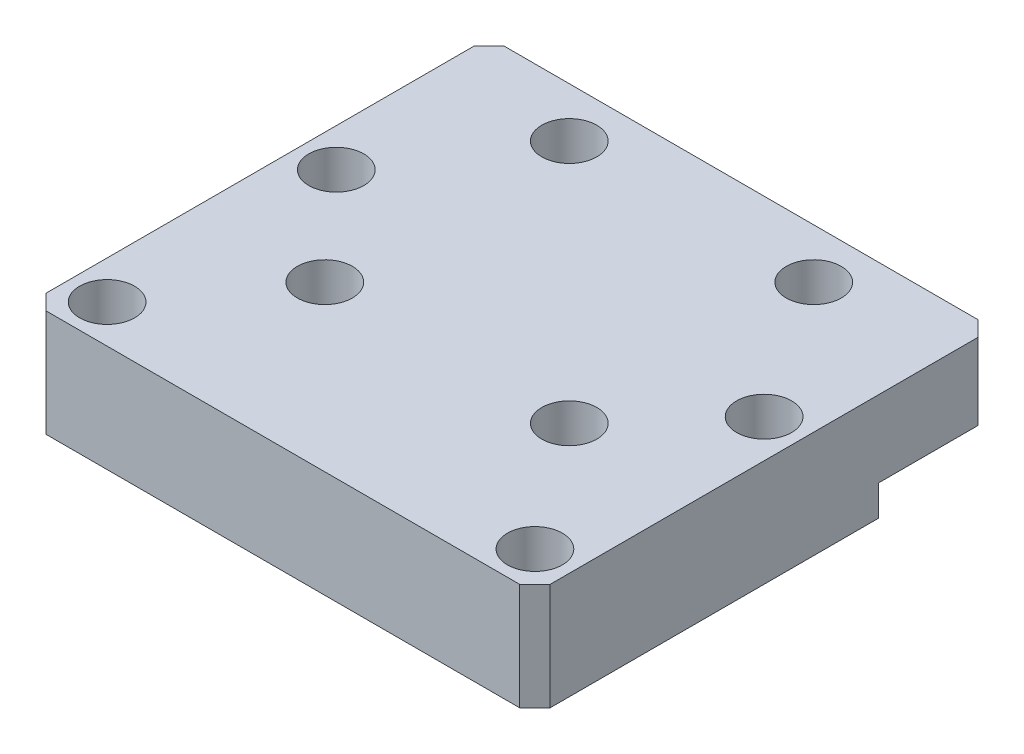
from build123d import *

# Parameters (mm, degrees)
BOSS_EXTRUDE1_DEPTH                                  = 7
M3_CLEARANCE_HOLE1_D                                 = 3.6
CUT_EXTRUDE1_DEPTH                                   = 22.16158075380949
CUT_EXTRUDE1_DEPTH_BACK                              = 2
BOSS_EXTRUDE2_DEPTH                                  = 5
FILLET1_R                                            = 5.5
CHAMFER1_SIZE                                        = 1
CBORE_FOR_M3_HEXAGON_SOCKET_HEAD_CAP_SCR_D           = 3.6
CBORE_FOR_M3_HEXAGON_SOCKET_HEAD_CAP_SCR_CBORE_D     = 6
CBORE_FOR_M3_HEXAGON_SOCKET_HEAD_CAP_SCR_CBORE_DEPTH = 4.4
FILLET2_R                                            = 2


with BuildPart() as part:
    # Sketch1 → Boss-Extrude1 (new body)
    with BuildSketch(Plane(origin=(0, 0, 0), x_dir=(1, 0, 0), z_dir=(0, 1, 0))):
        Polygon((16.5, -11.249999999999996), (-16.499999999999996, -11.250000000000002), (-16.499999999999996, 11.249999999999998), (16.500000000000004, 11.250000000000002), align=None)
    extrude(amount=BOSS_EXTRUDE1_DEPTH)

    # M3 Clearance Hole1 (through all)
    with Locations(Plane(origin=(-14, 7, -6.25), x_dir=(0, 0, 1), z_dir=(0, 1, 0))):
        with Locations((0, 0), (0, 28), (15, 28), (15, 0)):
            Hole(M3_CLEARANCE_HOLE1_D / 2)

    # Sketch7 → Cut-Extrude1 (cut, two sides: drawn at the far end of the back side and taken through both)
    with BuildSketch(Plane.XZ.offset(-CUT_EXTRUDE1_DEPTH_BACK)):
        Polygon((-1.78e-15, 7.784737974375178), (-14.605868156846089, -11.250000000000002), (14.605868156846089, -11.250000000000002), align=None)
    extrude(amount=CUT_EXTRUDE1_DEPTH + CUT_EXTRUDE1_DEPTH_BACK, mode=Mode.SUBTRACT)

    # Sketch8 → Boss-Extrude2 (add)
    with BuildSketch(Plane.XZ.offset(-2)):
        Polygon((-16.499999999999996, -11.249999999999998), (16.500000000000004, -11.250000000000002), (16.500000000000004, -18.749999999999996), (-16.499999999999996, -18.749999999999996), align=None)
    extrude(amount=-BOSS_EXTRUDE2_DEPTH)

    # Fillet1
    fillet1_edges = [part.edges().sort_by_distance(p)[0] for p in [
        (0, 1, 7.784737974375178),
    ]]
    fillet(fillet1_edges, radius=FILLET1_R)

    # Chamfer1
    chamfer1_edges = [part.edges().sort_by_distance(p)[0] for p in [
        (16.500000000000004, 4.5, -18.749999999999996),
        (-16.499999999999996, 4.5, -18.749999999999996),
        (16.5, 3.5, 11.249999999999996),
        (-16.499999999999996, 3.5, 11.250000000000002),
    ]]
    chamfer(chamfer1_edges, length=CHAMFER1_SIZE)

    # CBORE for M3 Hexagon socket head cap screws1 (through all)
    with Locations(Plane(origin=(-8, 0, 0.5), x_dir=(0, 0, -1), z_dir=(0, -1, 0))):
        with Locations((0, 0), (0, 16), (16, 0), (16, 16)):
            CounterBoreHole(CBORE_FOR_M3_HEXAGON_SOCKET_HEAD_CAP_SCR_D / 2, CBORE_FOR_M3_HEXAGON_SOCKET_HEAD_CAP_SCR_CBORE_D / 2, CBORE_FOR_M3_HEXAGON_SOCKET_HEAD_CAP_SCR_CBORE_DEPTH)

    # Fillet2
    # the kernel refuses this fillet: 2 mm, written as the material it takes off along each edge
    with BuildSketch(Plane(origin=(7.890215098826709, 2, -2.497990539590539), x_dir=(0.6087614290087221, 0, -0.793353340291234), z_dir=(0, -1, 0))) as fillet2_piece_1:
        with BuildLine():
            CenterArc((2.6875953448217693, 1.9999999999999998), FILLET2_R, 181.00663294290118, 88.9933670570988)
            ThreePointArc((0.6879040087236102, 1.9648636892380578), (0.5198514245240395, 0.9208489893174272), (0, 0))
            Line((0, 0), (2.687595344821769, -6e-17))
        make_face()
    extrude(amount=8.718988362054422, mode=Mode.SUBTRACT)
    with BuildSketch(Plane(origin=(5.075749087550851, 2, 1.169892977303331), x_dir=(0.5345809158392569, 0, 0.8451172962497344), z_dir=(0, -1, 0))) as fillet2_piece_2:
        with BuildLine():
            CenterArc((2.658961571108191, 1.8862980173372965), FILLET2_R, 171.49145576395077, 79.09584417917802)
            Line((0.6809739505501902, 2.182211810390776), (0.48317518849439006, 2.2118031896961234))
            ThreePointArc((0.48317518849439006, 2.2118031896961234), (0.21601574537907067, 1.167239486619447), (-0.18771727363639942, 0.06900887753410519))
            Line((-0.18771727363639942, 0.06900887753410519), (0.06647403927770486, -0.18862980173372967))
            ThreePointArc((0.06647403927770486, -0.18862980173372967), (0.9971105891655724, -0.02944702600594452), (1.9277471390534389, -0.18862980173372967))
            Line((1.9277471390534389, -0.18862980173372967), (1.9942211783311437, -1.1e-16))
        make_face()
    extrude(amount=7.714987919244077, mode=Mode.SUBTRACT)
    with BuildSketch(Plane(origin=(-5.075749087550852, 2, 1.169892977303333), x_dir=(0.6475032352688438, 0, 0.76206270104), z_dir=(0, -1, 0))) as fillet2_piece_3:
        with BuildLine():
            CenterArc((2.5927374915549515, 1.9763373059158453), FILLET2_R, 182.08181462888786, 79.09584417902704)
            Line((0.594057543639052, 1.9036842550583746), (0.39418954884746193, 1.8964189499726276))
            ThreePointArc((0.39418954884746193, 1.8964189499726276), (0.2689186301864014, 0.960614087293723), (-0.16026415854934645, 0.11964697858479319))
            Line((-0.16026415854934645, 0.11964697858479319), (0.00995689513411226, -0.19975199683429518))
            ThreePointArc((0.00995689513411226, -0.19975199683429518), (1.1785960560365805, -0.14149967515975187), (2.2553209353120622, -0.19763373059158465))
            Line((2.2553209353120622, -0.19763373059158465), (2.2859951676977794, 3e-17))
        make_face()
    extrude(amount=7.714987919244448, mode=Mode.SUBTRACT)
    with BuildSketch(Plane(origin=(-7.890215098826712, 2, -2.497990539590539), x_dir=(-0.9499463523512466, 0, 0.3124130721569783), z_dir=(0, -1, 0))) as fillet2_piece_4:
        with BuildLine():
            CenterArc((2.7757365364902538, 1.8757546261437203), FILLET2_R, 160.70471375400504, 88.99336705710107)
            Line((0.8880802565250356, 2.53662811532896), (0, 0))
            ThreePointArc((0, 0), (1.040901201183847, 0.18636806078441912), (2.0818024023676904, -4e-17))
        make_face()
    extrude(amount=8.718988362054088, mode=Mode.SUBTRACT)


solid = part.part
